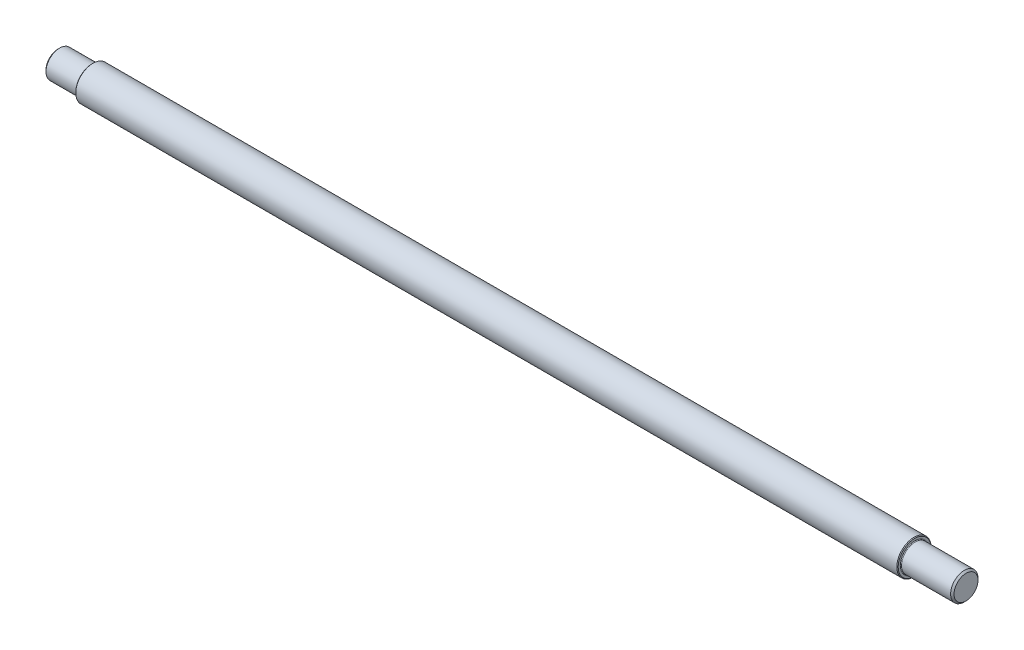
from build123d import *

# Parameters (mm, degrees)
CHAMFER1_SIZE = 0.2
CHAMFER2_SIZE = 0.2
CHAMFER3_SIZE = 0.5
CHAMFER4_SIZE = 0.5
FILLET1_R     = 0.2
FILLET2_R     = 0.2


with BuildPart() as part:
    # Sketch1 → Revolve1 (revolve)
    with BuildSketch(Plane.XY):
        Polygon((0, 0), (265, 0), (265, 4), (250, 4), (250, 5), (10, 5), (10, 4), (0, 4), align=None)
    revolve(axis=Axis((0, 0, 0), (1, 0, 0)))

    # Chamfer1
    chamfer1_edges = [part.edges().sort_by_distance(p)[0] for p in [
        (250, -5, 0),
    ]]
    chamfer(chamfer1_edges, length=CHAMFER1_SIZE)

    # Chamfer2
    chamfer2_edges = [part.edges().sort_by_distance(p)[0] for p in [
        (10, -5, 0),
    ]]
    chamfer(chamfer2_edges, length=CHAMFER2_SIZE)

    # Chamfer3
    chamfer3_edges = [part.edges().sort_by_distance(p)[0] for p in [
        (0, -4, 0),
    ]]
    chamfer(chamfer3_edges, length=CHAMFER3_SIZE)

    # Chamfer4
    chamfer4_edges = [part.edges().sort_by_distance(p)[0] for p in [
        (265, -4, 0),
    ]]
    chamfer(chamfer4_edges, length=CHAMFER4_SIZE)

    # Fillet1
    fillet1_edges = [part.edges().sort_by_distance(p)[0] for p in [
        (10, -4, 0),
    ]]
    fillet(fillet1_edges, radius=FILLET1_R)

    # Fillet2
    fillet2_edges = [part.edges().sort_by_distance(p)[0] for p in [
        (250, -4, 0),
    ]]
    fillet(fillet2_edges, radius=FILLET2_R)


solid = part.part
